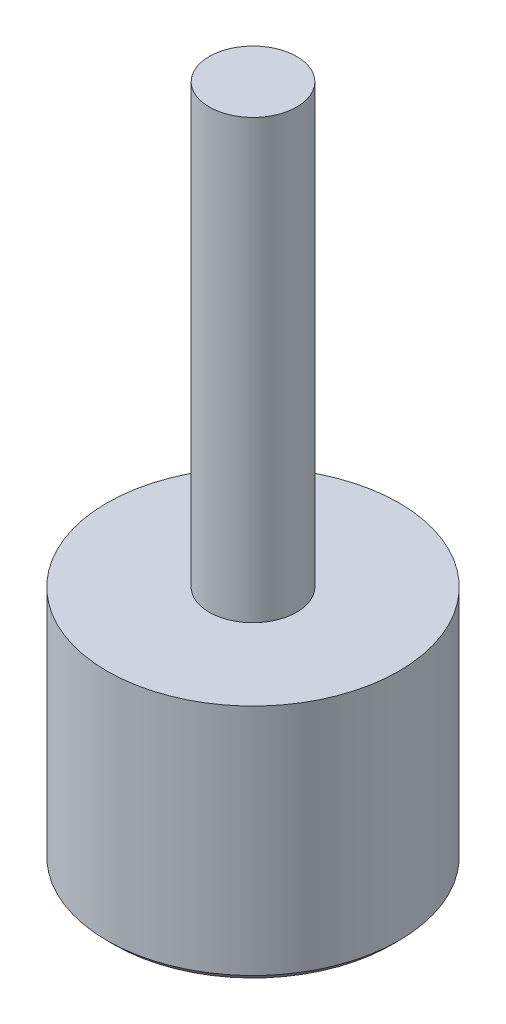
from build123d import *

# Parameters (mm, degrees)
ESQUISSE1_R        = 10
ESQUISSE1_R_2      = 3.5
BOSS_EXTRU_1_DEPTH = 4
BOSS_EXTRU_2_START = 10
ESQUISSE2_R        = 10
ESQUISSE2_R_2      = 6.75
BOSS_EXTRU_2_DEPTH = 10
BOSS_EXTRU_3_START = 1.5
BOSS_EXTRU_3_DEPTH = 1.5
CONG_1_R           = 2
BOSS_EXTRU_6_START = -2
ESQUISSE13_R       = 3.5
BOSS_EXTRU_6_DEPTH = 2
ESQUISSE15_R       = 10
BOSS_EXTRU_7_DEPTH = 2
ESQUISSE21_R       = 3
BOSS_EXTRU_8_DEPTH = 30


with BuildPart() as part:
    # Esquisse1 → Boss.-Extru.1 (new body)
    with BuildSketch(Plane(origin=(0, 0, 0), x_dir=(1, 0, 0), z_dir=(0, 1, 0))):
        with Locations(Location((0, 0, 0), (0, 0, 270))):
            Circle(ESQUISSE1_R)
        with Locations(Location((0, 0, 0), (0, 0, 270))):
            Circle(ESQUISSE1_R_2, mode=Mode.SUBTRACT)
    extrude(amount=BOSS_EXTRU_1_DEPTH)

    # Esquisse2 → Boss.-Extru.2 (add)
    with BuildSketch(Plane.XZ.offset(BOSS_EXTRU_2_START)):
        with Locations(Location((0, 0, 0), (0, 0, 270))):
            Circle(ESQUISSE2_R)
        with Locations(Location((0, 0, 0), (0, 0, 270))):
            Circle(ESQUISSE2_R_2, mode=Mode.SUBTRACT)
    extrude(amount=-BOSS_EXTRU_2_DEPTH)

    # Esquisse5 → Révolution2 (revolve)
    with BuildSketch(Plane(origin=(0, 0, 0), x_dir=(0, 0, -1), z_dir=(1, 0, 0))):
        Polygon((-10, -10), (-6.75, -10), (-6.250000000000001, -10.499999999999995), (-9.500000000000004, -10.499999999999993), align=None)
    revolve(axis=Axis((0, 0, 0), (0, -1, 0)))

    # Esquisse7 → Boss.-Extru.3 (add)
    with BuildSketch(Plane.XZ.offset(BOSS_EXTRU_3_START)):
        with BuildLine():
            ThreePointArc((-3.471641565041511, 0.4446401285040917), (-3.3915764747476542, 0.8644125264815606), (-3.260950790974577, 1.2712985246755686))
            Line((-3.260950790974577, 1.2712985246755686), (-6.288976525451004, 2.4517900118742246))
            ThreePointArc((-6.288976525451004, 2.4517900118742246), (-6.54089748701339, 1.6670813010714052), (-6.695308732580065, 0.8575202478290395))
            Line((-6.695308732580065, 0.8575202478290395), (-3.471641565041511, 0.4446401285040917))
        make_face()
        with BuildLine():
            ThreePointArc((-0.44464012850385526, -3.47164156504154), (-0.8644125264814398, -3.3915764747476906), (-1.2712985246755584, -3.2609507909745816))
            Line((-1.271298524675558, -3.2609507909745803), (-2.4517900118740936, -6.288976525450949))
            ThreePointArc((-2.4517900118740936, -6.28897652545095), (-1.6670813010712728, -6.54089748701333), (-0.8575202478289087, -6.69530873258001))
            Line((-0.8575202478289086, -6.695308732580009), (-0.4446401285038535, -3.4716415650415393))
        make_face()
        with BuildLine():
            ThreePointArc((3.4716415650415344, -0.44464012850390167), (3.391576474747708, -0.8644125264813738), (3.2609507909746505, -1.271298524675382))
            Line((3.2609507909746522, -1.2712985246753834), (6.288976525451078, -2.4517900118740386))
            ThreePointArc((6.288976525451079, -2.451790011874039), (6.540897487013439, -1.6670813010712129), (6.69530873258014, -0.8575202478288542))
            Line((6.6953087325801395, -0.8575202478288538), (3.471641565041585, -0.4446401285039065))
        make_face()
        with BuildLine():
            Line((0.857520247828984, 6.6953087325801945), (0.44464012850403645, 3.4716415650416406))
            ThreePointArc((0.44464012850402057, 3.4716415650415193), (0.8644125264815102, 3.391576474747673), (1.2712985246755357, 3.2609507909745905))
            Line((1.2712985246755355, 3.26095079097459), (2.4517900118741687, 6.288976525451134))
            ThreePointArc((2.4517900118741687, 6.288976525451133), (1.6670813010713434, 6.540897487013499), (0.857520247828984, 6.6953087325801945))
        make_face()
    extrude(amount=-BOSS_EXTRU_3_DEPTH)

    # Congé1
    # the kernel refuses this fillet: 2 mm, written as the material it adds along each edge
    with BuildSketch(Plane(origin=(-11.497312291654126, 0, 1.472550180954296), x_dir=(-0.1270400367153696, 0, -0.9918975900118709), z_dir=(0.9918975900118709, 0, -0.1270400367153696))) as cong_1_piece_1_section:
        with BuildLine():
            CenterArc((1.9364916731037083, -2), CONG_1_R, 90, 75.5224878140701)
            Line((-2.2e-16, -1.5), (0, 0))
            Line((0, 0), (1.9364916731037083, 0))
        make_face()
    cong_1_piece_1 = extrude(amount=12.932458365518517, mode=Mode.PRIVATE)
    cong_1_piece_1 = cong_1_piece_1 - Plane(origin=(0, 0, 0), x_dir=(-1.8e-16, 0, 1), z_dir=(0, -1, 0)) * Cylinder(3.5, 34, mode=Mode.PRIVATE)
    cong_1_piece_1 = cong_1_piece_1 & Plane(origin=(0, 0, 0), x_dir=(-1.8e-16, 0, -1), z_dir=(0, -1, 0)) * Cylinder(6.75, 34, mode=Mode.PRIVATE)
    add(cong_1_piece_1)
    with BuildSketch(Plane(origin=(1.2496235326849163, 0, -0.4871721946552088), x_dir=(0.3632281499072788, 0, 0.9317002259927467), z_dir=(-0.9317002259927468, 0, 0.3632281499072788))) as cong_1_piece_2_section:
        with BuildLine():
            CenterArc((1.9364916731037085, -2), CONG_1_R, 90, 75.5224878140701)
            Line((0, -1.5), (0, 0))
            Line((0, 0), (1.9364916731037085, 0))
        make_face()
    cong_1_piece_2 = extrude(amount=12.932458365518542, mode=Mode.PRIVATE)
    cong_1_piece_2 = cong_1_piece_2 - Plane(origin=(0, 0, 0), x_dir=(-1.8e-16, 0, 1), z_dir=(0, -1, 0)) * Cylinder(3.5, 34, mode=Mode.PRIVATE)
    cong_1_piece_2 = cong_1_piece_2 & Plane(origin=(0, 0, 0), x_dir=(-1.8e-16, 0, -1), z_dir=(0, -1, 0)) * Cylinder(6.75, 34, mode=Mode.PRIVATE)
    add(cong_1_piece_2)
    with BuildSketch(Plane(origin=(-1.4725501809543382, 0, -11.497312291654048), x_dir=(0.9918975900118664, 0, -0.12704003671540534), z_dir=(0.12704003671540534, 0, 0.9918975900118664))) as cong_1_piece_3_section:
        with BuildLine():
            CenterArc((1.9364916731037087, -2.0000000000000004), CONG_1_R, 90, 75.5224878140701)
            Line((0, -1.5000000000000004), (0, 0))
            Line((0, 0), (1.9364916731037087, 0))
        make_face()
    cong_1_piece_3 = extrude(amount=12.932458365518444, mode=Mode.PRIVATE)
    cong_1_piece_3 = cong_1_piece_3 - Plane(origin=(0, 0, 0), x_dir=(-1.8e-16, 0, 1), z_dir=(0, -1, 0)) * Cylinder(3.5, 34, mode=Mode.PRIVATE)
    cong_1_piece_3 = cong_1_piece_3 & Plane(origin=(0, 0, 0), x_dir=(-1.8e-16, 0, -1), z_dir=(0, -1, 0)) * Cylinder(6.75, 34, mode=Mode.PRIVATE)
    add(cong_1_piece_3)
    with BuildSketch(Plane(origin=(0.4871721946550931, 0, 1.2496235326849625), x_dir=(-0.9317002259927569, 0, 0.3632281499072527), z_dir=(-0.3632281499072527, 0, -0.931700225992757))) as cong_1_piece_4_section:
        with BuildLine():
            CenterArc((1.9364916731037085, -2), CONG_1_R, 90, 75.5224878140701)
            Line((0, -1.5), (0, 0))
            Line((0, 0), (1.9364916731037085, 0))
        make_face()
    cong_1_piece_4 = extrude(amount=12.932458365518446, mode=Mode.PRIVATE)
    cong_1_piece_4 = cong_1_piece_4 - Plane(origin=(0, 0, 0), x_dir=(-1.8e-16, 0, 1), z_dir=(0, -1, 0)) * Cylinder(3.5, 34, mode=Mode.PRIVATE)
    cong_1_piece_4 = cong_1_piece_4 & Plane(origin=(0, 0, 0), x_dir=(-1.8e-16, 0, -1), z_dir=(0, -1, 0)) * Cylinder(6.75, 34, mode=Mode.PRIVATE)
    add(cong_1_piece_4)
    with BuildSketch(Plane(origin=(11.4973122916542, 0, -1.4725501809541097), x_dir=(0.12704003671536943, 0, 0.9918975900118709), z_dir=(-0.991897590011871, 0, 0.12704003671536945))) as cong_1_piece_5_section:
        with BuildLine():
            CenterArc((1.9364916731037083, -2.0000000000000004), CONG_1_R, 90, 75.5224878140701)
            Line((-2.2e-16, -1.5000000000000004), (0, 0))
            Line((0, 0), (1.9364916731037083, 0))
        make_face()
    cong_1_piece_5 = extrude(amount=12.932458365518519, mode=Mode.PRIVATE)
    cong_1_piece_5 = cong_1_piece_5 - Plane(origin=(0, 0, 0), x_dir=(-1.8e-16, 0, 1), z_dir=(0, -1, 0)) * Cylinder(3.5, 34, mode=Mode.PRIVATE)
    cong_1_piece_5 = cong_1_piece_5 & Plane(origin=(0, 0, 0), x_dir=(-1.8e-16, 0, -1), z_dir=(0, -1, 0)) * Cylinder(6.75, 34, mode=Mode.PRIVATE)
    add(cong_1_piece_5)
    with BuildSketch(Plane(origin=(-1.2496235326848435, 0, 0.4871721946553944), x_dir=(-0.3632281499072787, 0, -0.9317002259927468), z_dir=(0.9317002259927469, 0, -0.3632281499072787))) as cong_1_piece_6_section:
        with BuildLine():
            CenterArc((1.936491673103709, -2), CONG_1_R, 90, 75.5224878140701)
            Line((2.1e-16, -1.5), (0, 0))
            Line((0, 0), (1.936491673103709, 0))
        make_face()
    cong_1_piece_6 = extrude(amount=12.932458365518547, mode=Mode.PRIVATE)
    cong_1_piece_6 = cong_1_piece_6 - Plane(origin=(0, 0, 0), x_dir=(-1.8e-16, 0, 1), z_dir=(0, -1, 0)) * Cylinder(3.5, 34, mode=Mode.PRIVATE)
    cong_1_piece_6 = cong_1_piece_6 & Plane(origin=(0, 0, 0), x_dir=(-1.8e-16, 0, -1), z_dir=(0, -1, 0)) * Cylinder(6.75, 34, mode=Mode.PRIVATE)
    add(cong_1_piece_6)
    with BuildSketch(Plane(origin=(1.4725501809542403, 0, 11.497312291654257), x_dir=(-0.9918975900118709, 0, 0.1270400367153695), z_dir=(-0.1270400367153695, 0, -0.9918975900118709))) as cong_1_piece_7_section:
        with BuildLine():
            CenterArc((1.936491673103709, -2), CONG_1_R, 90, 75.5224878140701)
            Line((2.2e-16, -1.5), (0, 0))
            Line((0, 0), (1.936491673103709, 0))
        make_face()
    cong_1_piece_7 = extrude(amount=12.93245836551852, mode=Mode.PRIVATE)
    cong_1_piece_7 = cong_1_piece_7 - Plane(origin=(0, 0, 0), x_dir=(-1.8e-16, 0, 1), z_dir=(0, -1, 0)) * Cylinder(3.5, 34, mode=Mode.PRIVATE)
    cong_1_piece_7 = cong_1_piece_7 & Plane(origin=(0, 0, 0), x_dir=(-1.8e-16, 0, -1), z_dir=(0, -1, 0)) * Cylinder(6.75, 34, mode=Mode.PRIVATE)
    add(cong_1_piece_7)
    with BuildSketch(Plane(origin=(-0.4871721946551535, 0, -1.2496235326849385), x_dir=(0.9317002259927538, 0, -0.3632281499072605), z_dir=(0.36322814990726054, 0, 0.931700225992754))) as cong_1_piece_8_section:
        with BuildLine():
            CenterArc((1.9364916731037085, -2), CONG_1_R, 90, 75.5224878140701)
            Line((0, -1.5), (0, 0))
            Line((0, 0), (1.9364916731037085, 0))
        make_face()
    cong_1_piece_8 = extrude(amount=12.932458365518647, mode=Mode.PRIVATE)
    cong_1_piece_8 = cong_1_piece_8 - Plane(origin=(0, 0, 0), x_dir=(-1.8e-16, 0, 1), z_dir=(0, -1, 0)) * Cylinder(3.5, 34, mode=Mode.PRIVATE)
    cong_1_piece_8 = cong_1_piece_8 & Plane(origin=(0, 0, 0), x_dir=(-1.8e-16, 0, -1), z_dir=(0, -1, 0)) * Cylinder(6.75, 34, mode=Mode.PRIVATE)
    add(cong_1_piece_8)

    # Esquisse13 → Boss.-Extru.6 (add)
    with BuildSketch(Plane(origin=(0, 4, 0), x_dir=(1, 0, 0), z_dir=(0, 1, 0)).offset(BOSS_EXTRU_6_START)):
        with Locations(Location((0, 0, 0), (0, 0, 97.298580632))):
            Circle(ESQUISSE13_R)
    extrude(amount=BOSS_EXTRU_6_DEPTH)

    # Esquisse15 → Boss.-Extru.7 (add)
    with BuildSketch(Plane(origin=(0, 4, 0), x_dir=(1, 0, 0), z_dir=(0, 1, 0))):
        with Locations(Location((0, 0, 0), (0, 0, 90))):
            Circle(ESQUISSE15_R)
    extrude(amount=BOSS_EXTRU_7_DEPTH)

    # Esquisse21 → Boss.-Extru.8 (add)
    with BuildSketch(Plane(origin=(0, 6, 0), x_dir=(1, 0, 0), z_dir=(0, 1, 0))):
        with Locations(Location((0, 0, 0), (0, 0, 270))):
            Circle(ESQUISSE21_R)
    extrude(amount=BOSS_EXTRU_8_DEPTH)


solid = part.part
